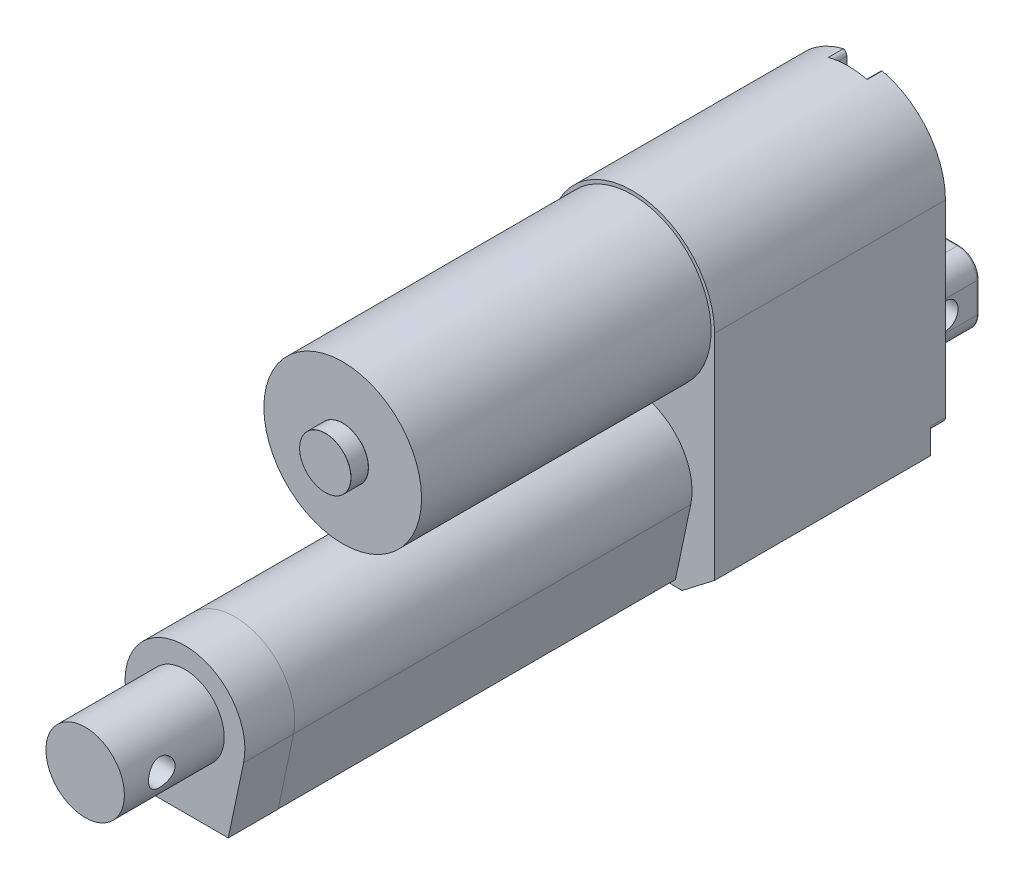
from build123d import *

# Parameters (mm, degrees)
BOSS_EXTRUDE1_DEPTH                      = 58.7375
SKETCH2_R                                = 20.066
BOSS_EXTRUDE2_DEPTH                      = 73.66
EDIT_LENGTH_HERE_HOVER_FOR_COMMENT_DEPTH = 113.792
SKETCH4_R                                = 9.9822
BOSS_EXTRUDE4_DEPTH                      = 25.4
BOSS_EXTRUDE5_DEPTH                      = 20.6502
CUT_EXTRUDE3_DEPTH                       = 217.231560923
CUT_EXTRUDE3_DEPTH_BACK                  = 217.231560923
SKETCH6_R                                = 3.3782
FILLET1_R                                = 2.54
FILLET2_R                                = 0.508
CUT_EXTRUDE5_DEPTH                       = 3.81
SKETCH8_R                                = 6.5405
BOSS_EXTRUDE6_DEPTH                      = 4.445
FILLET3_R                                = 0.0254
BOSS_EXTRUDE7_START                      = -12.7
BOSS_EXTRUDE7_DEPTH                      = 12.7
SKETCH10_R                               = 2.54
BOSS_EXTRUDE8_DEPTH                      = 0.635


with BuildPart() as part:
    # Sketch1 → Boss-Extrude1 (new body)
    with BuildSketch(Plane.XY):
        with BuildLine():
            Line((-12.7, 0), (12.7, 0))
            Line((12.7, 0), (20.955, 6.35))
            Line((20.955, 6.35), (20.955, 60.833))
            ThreePointArc((20.955, 60.833), (0, 81.788), (-20.955, 60.833))
            Line((-20.955, 60.833), (-20.955, 6.35))
            Line((-20.955, 6.35), (-12.7, 0))
        make_face()
    extrude(amount=BOSS_EXTRUDE1_DEPTH)

    # Sketch2 → Boss-Extrude2 (add)
    with BuildSketch(Plane.XY.offset(58.7375)):
        with Locations((0, 60.833)):
            Circle(SKETCH2_R)
    extrude(amount=BOSS_EXTRUDE2_DEPTH)

    # Sketch3 → EDIT_LENGTH_HERE (hover for comment) (add)
    with BuildSketch(Plane.XY.offset(58.7375)):
        with BuildLine():
            Line((-14.88814822, 20.042680112), (-10.996912775, 1.5621))
            Line((-10.996912775, 1.5621), (10.996912775, 1.5621))
            Line((10.996912775, 1.5621), (14.88814822, 20.042680112))
            ThreePointArc((14.88814822, 20.042680112), (0, 38.3921), (-14.88814822, 20.042680112))
        make_face()
    extrude(amount=EDIT_LENGTH_HERE_HOVER_FOR_COMMENT_DEPTH)

    # Sketch4 → Boss-Extrude4 (add)
    with BuildSketch(Plane.XY.offset(172.5295)):
        with Locations((0, 23.1775)):
            Circle(SKETCH4_R)
    extrude(amount=BOSS_EXTRUDE4_DEPTH)

    # Sketch5 → Boss-Extrude5 (add)
    with BuildSketch(Plane(origin=(0, 0, 0), x_dir=(-1, 0, 0), z_dir=(0, 0, -1))):
        with BuildLine():
            Line((-3.81, 32.0675), (3.81, 32.0675))
            ThreePointArc((3.81, 32.0675), (7.402102448, 30.579602448), (8.89, 26.9875))
            Line((8.89, 26.9875), (8.89, 19.3675))
            ThreePointArc((8.89, 19.3675), (7.402102448, 15.775397552), (3.81, 14.2875))
            Line((3.81, 14.2875), (-3.81, 14.2875))
            ThreePointArc((-3.81, 14.2875), (-7.402102448, 15.775397552), (-8.89, 19.3675))
            Line((-8.89, 19.3675), (-8.89, 26.9875))
            ThreePointArc((-8.89, 26.9875), (-7.402102448, 30.579602448), (-3.81, 32.0675))
        make_face()
    extrude(amount=BOSS_EXTRUDE5_DEPTH)

    # Sketch6 → Cut-Extrude3 (cut, two sides: drawn at the far end of the back side and taken through both)
    with BuildSketch(Plane(origin=(8.89, 0, 0), x_dir=(0, 0, -1), z_dir=(1, 0, 0)).offset(-CUT_EXTRUDE3_DEPTH_BACK)):
        with Locations((11.90625, 23.1775)):
            Circle(SKETCH6_R)
        with Locations((-188.4045, 23.1775)):
            Circle(SKETCH6_R)
    extrude(amount=CUT_EXTRUDE3_DEPTH + CUT_EXTRUDE3_DEPTH_BACK, mode=Mode.SUBTRACT)

    # Fillet1
    fillet1_edges = [part.edges().sort_by_distance(p)[0] for p in [
        (-7.402102448, 15.775397552, 0),
        (0, 14.2875, 0),
        (7.402102448, 15.775397552, 0),
        (8.89, 23.1775, 0),
        (7.402102448, 30.579602448, 0),
        (0, 32.0675, 0),
        (-7.402102448, 30.579602448, 0),
        (-8.89, 23.1775, 0),
    ]]
    fillet(fillet1_edges, radius=FILLET1_R)

    # Fillet2
    fillet2_edges = [part.edges().sort_by_distance(p)[0] for p in [
        (8.89, 23.1775, -20.6502),
        (7.402102448, 30.579602448, -20.6502),
        (0, 32.0675, -20.6502),
        (-7.402102448, 30.579602448, -20.6502),
        (-8.89, 23.1775, -20.6502),
        (-7.402102448, 15.775397552, -20.6502),
        (0, 14.2875, -20.6502),
        (7.402102448, 15.775397552, -20.6502),
    ]]
    fillet(fillet2_edges, radius=FILLET2_R)

    # Sketch7 → Cut-Extrude5 (cut)
    with BuildSketch(Plane(origin=(0, 0, 0), x_dir=(-1, 0, 0), z_dir=(0, 0, -1))):
        with BuildLine():
            ThreePointArc((-19.685, 11.610879552), (-20.583025612, 11.98285394), (-20.955, 12.880879552))
            Line((-20.955, 12.880879552), (-20.955, 6.35))
            Line((-20.955, 6.35), (-13.042377801, 0.26336754))
            ThreePointArc((-13.042377801, 0.26336754), (-13.507857108, 0.994743297), (-13.395607029, 1.854383572))
            Line((-13.395607029, 1.854383572), (-11.222314297, 6.047728836))
            ThreePointArc((-11.222314297, 6.047728836), (-11.349573436, 9.780348644), (-14.605, 11.610879552))
            Line((-14.605, 11.610879552), (-19.685, 11.610879552))
        make_face()
        with BuildLine():
            Line((20.955, 6.35), (20.955, 12.880879552))
            ThreePointArc((20.955, 12.880879552), (20.583025612, 11.98285394), (19.685, 11.610879552))
            Line((19.685, 11.610879552), (14.605, 11.610879552))
            ThreePointArc((14.605, 11.610879552), (11.203032914, 9.51631534), (11.541558483, 5.535614431))
            Line((11.541558483, 5.535614431), (13.402295436, 1.841293477))
            ThreePointArc((13.402295436, 1.841293477), (13.506243345, 0.987572709), (13.042377827, 0.263367559))
            Line((13.042377827, 0.263367559), (20.955, 6.35))
        make_face()
        with BuildLine():
            Line((-4.1275, 80.068311519), (-4.1275, 77.089))
            ThreePointArc((-4.1275, 77.089), (0, 72.9615), (4.1275, 77.089))
            Line((4.1275, 77.089), (4.1275, 79.978628931))
            ThreePointArc((4.1275, 79.978628931), (4.367379625, 80.721429048), (4.996400809, 81.183626623))
            ThreePointArc((4.996400809, 81.183626623), (0.071861599, 81.787876781), (-4.856706104, 81.217416372))
            ThreePointArc((-4.856706104, 81.217416372), (-4.325187488, 80.748786262), (-4.1275, 80.068311519))
        make_face()
    extrude(amount=-CUT_EXTRUDE5_DEPTH, mode=Mode.SUBTRACT)

    # Sketch8 → Boss-Extrude6 (add)
    with BuildSketch(Plane.XY.offset(132.3975)):
        with Locations((0, 60.833)):
            Circle(SKETCH8_R)
    extrude(amount=BOSS_EXTRUDE6_DEPTH)

    # Fillet3
    fillet3_edges = [part.edges().sort_by_distance(p)[0] for p in [
        (-6.5405, 60.833, 132.3975),
        (-6.5405, 60.833, 136.8425),
    ]]
    fillet(fillet3_edges, radius=FILLET3_R)

    # Sketch9 → Boss-Extrude7 (add)
    with BuildSketch(Plane.XY.offset(172.5295).offset(BOSS_EXTRUDE7_START)):
        with BuildLine():
            Line((-11.017521545, 1.5367), (11.017521545, 1.5367))
            Line((11.017521545, 1.5367), (14.913003226, 20.03744669))
            ThreePointArc((14.913003226, 20.03744669), (0, 38.4175), (-14.913003226, 20.03744669))
            Line((-14.913003226, 20.03744669), (-11.017521545, 1.5367))
        make_face()
        with BuildLine():
            Line((10.996912775, 1.5621), (14.88814822, 20.042680112))
            ThreePointArc((14.88814822, 20.042680112), (0, 38.3921), (-14.88814822, 20.042680112))
            Line((-14.88814822, 20.042680112), (-10.996912775, 1.5621))
            Line((-10.996912775, 1.5621), (10.996912775, 1.5621))
        make_face(mode=Mode.SUBTRACT)
    extrude(amount=BOSS_EXTRUDE7_DEPTH)

    # Sketch10 → Boss-Extrude8 (add)
    with BuildSketch(Plane(origin=(0, 0, 3.81), x_dir=(-1, 0, 0), z_dir=(0, 0, -1))):
        with Locations((0, 77.089)):
            Circle(SKETCH10_R)
        with Locations((-14.605, 7.800879552)):
            Circle(SKETCH10_R)
        with Locations((14.605, 7.800879552)):
            Circle(SKETCH10_R)
    extrude(amount=BOSS_EXTRUDE8_DEPTH)


solid = part.part
